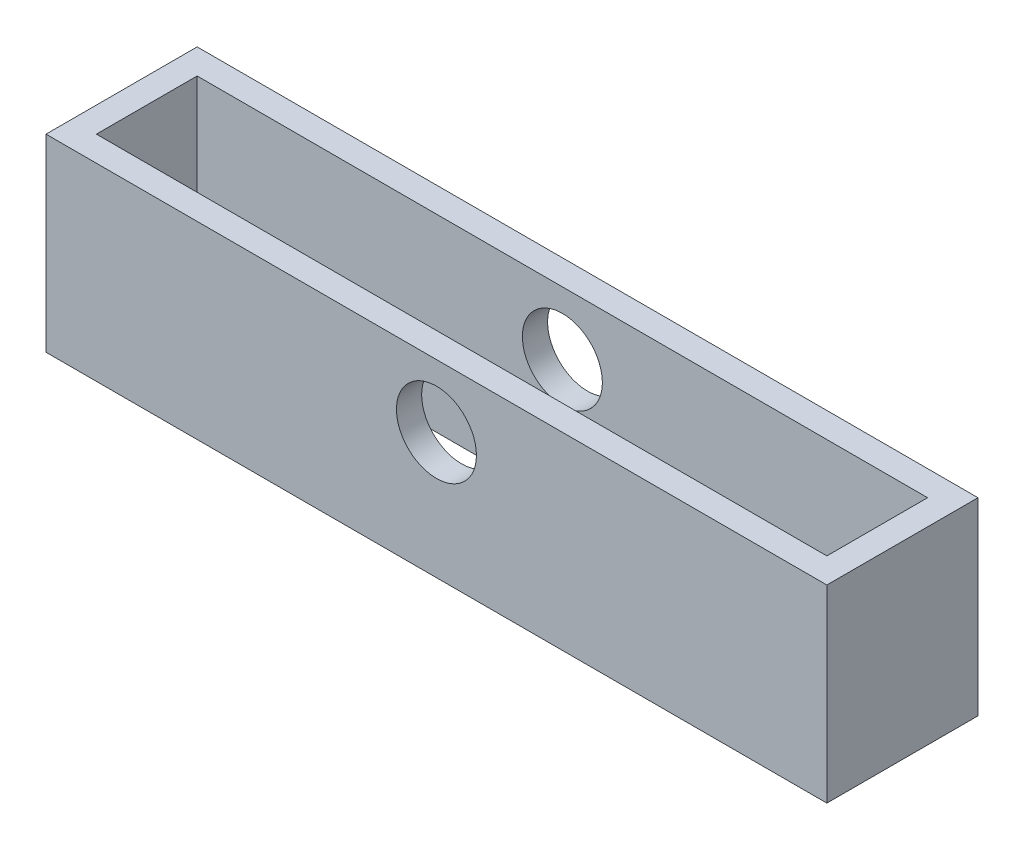
from build123d import *

# Parameters (mm, degrees)
ESQUISSE1_W             = 62
ESQUISSE1_H             = 12
ESQUISSE1_W_2           = 58
ESQUISSE1_H_2           = 8
BOSS_EXTRU_1_DEPTH      = 15
ESQUISSE2_R             = 3.175
ENL_V_MAT_EXTRU_1_DEPTH = 37.469165058


with BuildPart() as part:
    # Esquisse1 → Boss.-Extru.1 (new body)
    with BuildSketch(Plane(origin=(0, 0, 0), x_dir=(1, 0, 0), z_dir=(0, 1, 0))):
        Rectangle(ESQUISSE1_W, ESQUISSE1_H)
        Rectangle(ESQUISSE1_W_2, ESQUISSE1_H_2, mode=Mode.SUBTRACT)
    extrude(amount=BOSS_EXTRU_1_DEPTH)

    # Esquisse2 → Enlèv. mat.-Extru.1 (cut, through all)
    with BuildSketch(Plane.XY.offset(6)):
        with Locations((0, 10)):
            Circle(ESQUISSE2_R)
    extrude(amount=-ENL_V_MAT_EXTRU_1_DEPTH, mode=Mode.SUBTRACT)


solid = part.part
